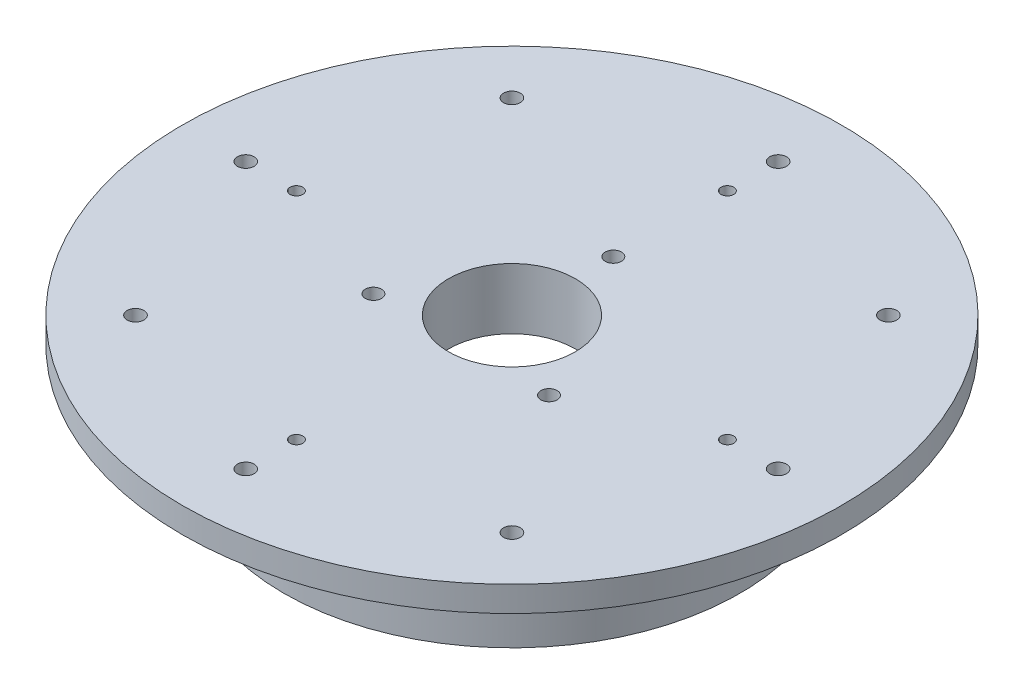
from build123d import *

# Parameters (mm, degrees)
SKETCH_1_R             = 65
EXTRUDE_1_DEPTH        = 5
SKETCH_2_R             = 50
EXTRUDE_2_DEPTH        = 7
SKETCH_3_R             = 1.6
CUT_EXTRUDE_1_DEPTH    = 58
SKETCH_4_R             = 12.5
CUT_EXTRUDE_2_DEPTH    = 93.703829479
SKETCH_5_R             = 45
SKETCH_5_R_2           = 40
EXTRUDE_3_DEPTH        = 13
HOLE_WIZARD_M3_1_D     = 2.5
SKETCH_9_R             = 1.6
CUT_EXTRUDE_3_DEPTH    = 10
HOLE_WIZARD_M4_3_D     = 3.3
HOLE_WIZARD_M4_3_DEPTH = 9.5
HOLE_WIZARD_M4_3_TIP   = 0.991420021


with BuildPart() as part:
    # 草图1 → 凸台-拉伸1 (new body)
    with BuildSketch(Plane(origin=(0, 0, 0), x_dir=(1, 0, 0), z_dir=(0, 1, 0))):
        Circle(SKETCH_1_R)
    extrude(amount=EXTRUDE_1_DEPTH)

    # 草图2 → 凸台-拉伸2 (add)
    with BuildSketch(Plane(origin=(0, 0, 0), x_dir=(-1, 0, 0), z_dir=(0, -1, 0))):
        Circle(SKETCH_2_R)
    extrude(amount=EXTRUDE_2_DEPTH)

    # 草图3 → 切除-拉伸1 (cut)
    with BuildSketch(Plane(origin=(0, 5, 0), x_dir=(1, 0, 0), z_dir=(0, 1, 0))):
        with Locations((0, 20)):
            Circle(SKETCH_3_R)
        with Locations((17.320508076, -10)):
            Circle(SKETCH_3_R)
        with Locations((-17.320508076, -10)):
            Circle(SKETCH_3_R)
    extrude(amount=-CUT_EXTRUDE_1_DEPTH, mode=Mode.SUBTRACT)

    # 草图4 → 切除-拉伸2 (cut, through all)
    with BuildSketch(Plane(origin=(0, -7, 0), x_dir=(-1, 0, 0), z_dir=(0, -1, 0))):
        Circle(SKETCH_4_R)
    extrude(amount=-CUT_EXTRUDE_2_DEPTH, mode=Mode.SUBTRACT)

    # 草图5 → 凸台-拉伸3 (add)
    with BuildSketch(Plane(origin=(0, -7, 0), x_dir=(-1, 0, 0), z_dir=(0, -1, 0))):
        Circle(SKETCH_5_R)
        Circle(SKETCH_5_R_2, mode=Mode.SUBTRACT)
    extrude(amount=EXTRUDE_3_DEPTH)

    # M3 螺纹孔1 (through all)
    with Locations(Plane(origin=(0, -20, 42.5), x_dir=(0, 0, -1), z_dir=(0, -1, 0))):
        with Locations((0, 0), (42.5, -42.5), (85, 0), (42.5, 42.5)):
            Hole(HOLE_WIZARD_M3_1_D / 2)

    # 草图9 → 切除-拉伸3 (cut)
    with BuildSketch(Plane(origin=(0, 5, 0), x_dir=(1, 0, 0), z_dir=(0, 1, 0))):
        with Locations((0, 52.5)):
            Circle(SKETCH_9_R)
        with Locations((37.123106012, 37.123106012)):
            Circle(SKETCH_9_R)
        with Locations((52.5, 0)):
            Circle(SKETCH_9_R)
        with Locations((37.123106012, -37.123106012)):
            Circle(SKETCH_9_R)
        with Locations((0, -52.5)):
            Circle(SKETCH_9_R)
        with Locations((-37.123106012, -37.123106012)):
            Circle(SKETCH_9_R)
        with Locations((-52.5, 0)):
            Circle(SKETCH_9_R)
        with Locations((-37.123106012, 37.123106012)):
            Circle(SKETCH_9_R)
    extrude(amount=-CUT_EXTRUDE_3_DEPTH, mode=Mode.SUBTRACT)

    # M4 螺纹孔3
    with Locations(Plane(origin=(0, 5, -52.5), x_dir=(0, 0, 1), z_dir=(0, 1, 0))):
        with Locations((0, 0), (15.376893988, 37.123106012), (52.5, 52.5), (89.623106012, 37.123106012), (105, 0), (89.623106012, -37.123106012), (52.5, -52.5), (15.376893988, -37.123106012)):
            Hole(HOLE_WIZARD_M4_3_D / 2, depth=HOLE_WIZARD_M4_3_DEPTH)
            with Locations((0, 0, -(HOLE_WIZARD_M4_3_DEPTH + HOLE_WIZARD_M4_3_TIP / 2))):  # 118° drill point
                Cone(0, HOLE_WIZARD_M4_3_D / 2, HOLE_WIZARD_M4_3_TIP, mode=Mode.SUBTRACT)


solid = part.part
